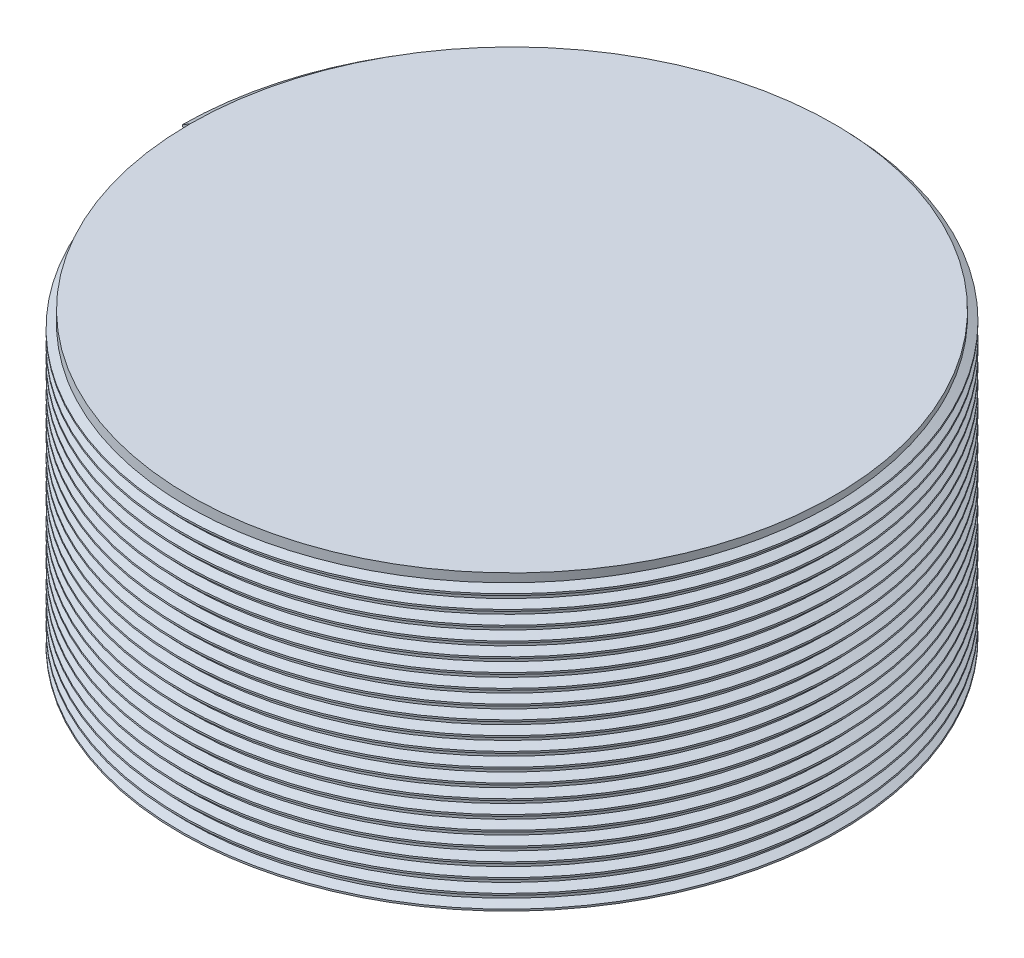
from build123d import *

# Parameters (mm, degrees)
SKETCH1_R                     = 14.15
BOSS_EXTRUDE1_DEPTH           = 12.7
MINCOLWIDTH_ONTRACKING1_PITCH = 0.6


with BuildPart() as part:
    # Sketch1 → Boss-Extrude1 (new body)
    with BuildSketch(Plane(origin=(0, 0, 0), x_dir=(1, 0, 0), z_dir=(0, 1, 0))):
        with Locations(Location((0, 0, 0), (0, 0, 270))):
            Circle(SKETCH1_R)
    extrude(amount=BOSS_EXTRUDE1_DEPTH)

    # MinColWidth_OnTracking1: the profile of HeaderRowsCount1 profile screwed along a right-hand helix of 21.166667 turns, 6 arcs to a turn; built about Z, then put on its axis
    mincolwidth_ontracking1_z = Axis((0, 0, 0), (0, 0, 1))
    mincolwidth_ontracking1_corners = [(14.1497, 0, -0.000173205), (14.474759525, 0, 0.187499999), (14.474759525, 0, 0.262499999), (14.1497, 0, 0.450173203)]
    with BuildLine(mode=Mode.PRIVATE) as mincolwidth_ontracking1_profile:
        Line(mincolwidth_ontracking1_corners[0], mincolwidth_ontracking1_corners[1])
        Line(mincolwidth_ontracking1_corners[1], mincolwidth_ontracking1_corners[2])
        Line(mincolwidth_ontracking1_corners[2], mincolwidth_ontracking1_corners[3])
        Line(mincolwidth_ontracking1_corners[3], mincolwidth_ontracking1_corners[0])
    mincolwidth_ontracking1_cap = Face(mincolwidth_ontracking1_profile.wire())
    mincolwidth_ontracking1_turn_angles = [0, 30, 60, 90, 120, 150, 180, 210, 240, 270, 300, 330, 360]
    mincolwidth_ontracking1_turn_weights = [1, 0.8660254037844387, 1, 0.8660254037844387, 1, 0.8660254037844387, 1, 0.8660254037844387, 1, 0.8660254037844387, 1, 0.8660254037844387, 1]
    mincolwidth_ontracking1_turn_rails = [Edge.make_bspline([Vector(p[0], p[1], 0).rotate(mincolwidth_ontracking1_z, mincolwidth_ontracking1_turn_angles[k]) / mincolwidth_ontracking1_turn_weights[k] + Vector(0, 0, p[2] + MINCOLWIDTH_ONTRACKING1_PITCH * mincolwidth_ontracking1_turn_angles[k] / 360) for k in range(13)], [0, 0, 0, 1, 1, 2, 2, 3, 3, 4, 4, 5, 5, 6, 6, 6], 2, mincolwidth_ontracking1_turn_weights) for p in mincolwidth_ontracking1_corners]
    mincolwidth_ontracking1_turn_sides = [Face.make_surface_from_curves(mincolwidth_ontracking1_turn_rails[p[0]], mincolwidth_ontracking1_turn_rails[p[1]]) for p in [(0, 1), (1, 2), (2, 3), (3, 0)]]
    mincolwidth_ontracking1_last_angles = [7560, 7590, 7620]
    mincolwidth_ontracking1_last_weights = [1, 0.8660254037844387, 1]
    mincolwidth_ontracking1_last_rails = [Edge.make_bspline([Vector(p[0], p[1], 0).rotate(mincolwidth_ontracking1_z, mincolwidth_ontracking1_last_angles[k]) / mincolwidth_ontracking1_last_weights[k] + Vector(0, 0, p[2] + MINCOLWIDTH_ONTRACKING1_PITCH * mincolwidth_ontracking1_last_angles[k] / 360) for k in range(3)], [0, 0, 0, 1, 1, 1], 2, mincolwidth_ontracking1_last_weights) for p in mincolwidth_ontracking1_corners]
    mincolwidth_ontracking1_last_sides = [Face.make_surface_from_curves(mincolwidth_ontracking1_last_rails[p[0]], mincolwidth_ontracking1_last_rails[p[1]]) for p in [(0, 1), (1, 2), (2, 3), (3, 0)]]
    mincolwidth_ontracking1 = Plane(origin=(0, 12.7, 0), x_dir=(-1, 0, 0), z_dir=(0, -1, 0)) * Solid(Shell([*[p.moved(Location((0, 0, MINCOLWIDTH_ONTRACKING1_PITCH * i))) for i in range(21) for p in mincolwidth_ontracking1_turn_sides], *mincolwidth_ontracking1_last_sides, mincolwidth_ontracking1_cap, mincolwidth_ontracking1_cap.rotate(mincolwidth_ontracking1_z, 7620).moved(Location((0, 0, MINCOLWIDTH_ONTRACKING1_PITCH * 7620 / 360)))]))
    add(mincolwidth_ontracking1)


solid = part.part
